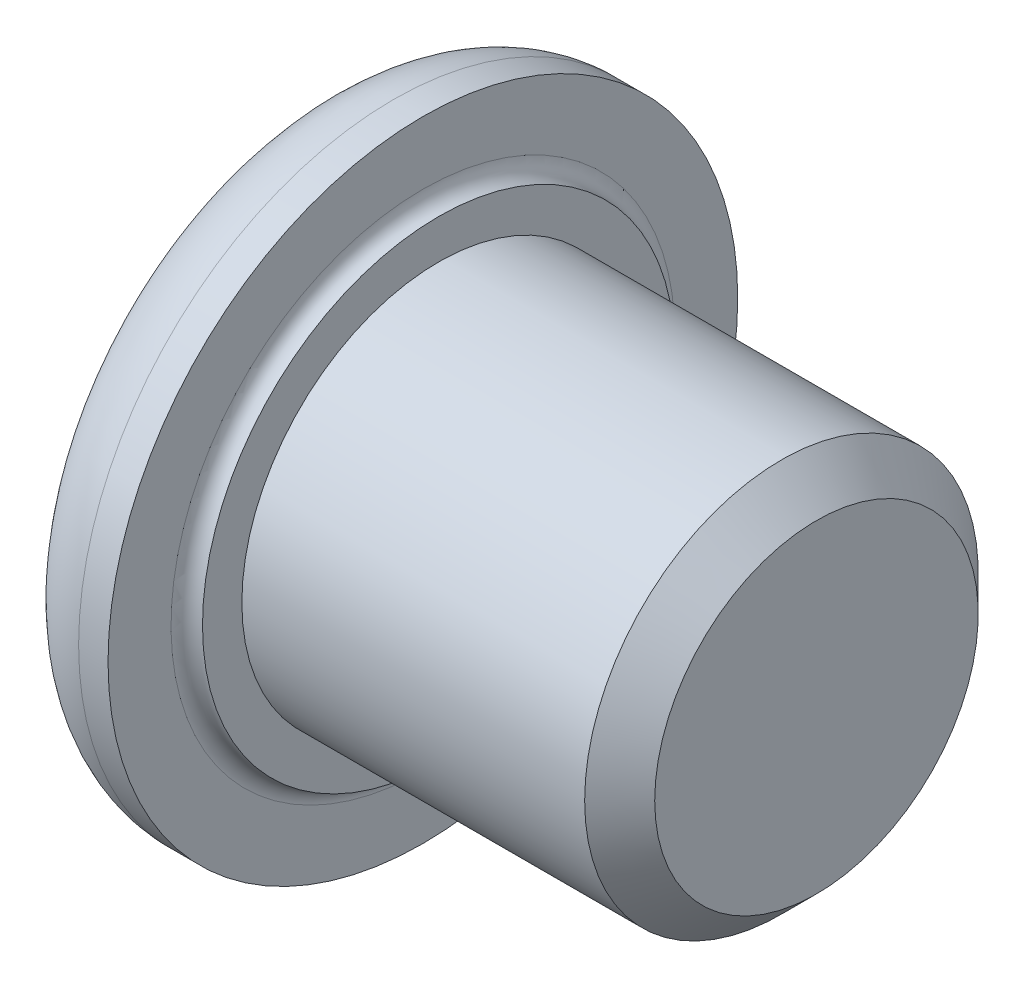
from build123d import *

# Parameters (mm, degrees)
ENL_V_MAT_EXTRU_1_DEPTH = 0.5
CONG_1_R                = 0.2
CONG_2_R                = 1


# Read off the part's stored shape, not the designer's step: M5 Filetages mécaniques Borne1
with BuildPart() as part:
    # Esquisse1 → Révolution1 (revolve)
    with BuildSketch(Plane.XY):
        with BuildLine():
            Line((0, 0), (-7, 0))
            ThreePointArc((-7, 0), (-6.746211251, 2.061552813), (-6, 4))
            Line((-6, 4), (-5, 4))
            Line((-5, 4), (-5, 3))
            Line((-5, 3), (0, 3))
            Line((0, 3), (0, 0))
        make_face()
    revolve(axis=Axis((0, 0, 0), (-1, 0, 0)))

    # Esquisse2 → Enlèv. mat.-Extru.1 (cut)
    with BuildSketch(Plane.ZY.offset(7)):
        Polygon((0.75, 1.299038106), (-0.75, 1.299038106), (-1.5, 0), (-0.75, -1.299038106), (0.75, -1.299038106), (1.5, 0), align=None)
    extrude(amount=-ENL_V_MAT_EXTRU_1_DEPTH, mode=Mode.SUBTRACT)

    # Congé1
    cong_1_edges = [part.edges().sort_by_distance(p)[0] for p in [
        (-5, -3, 0),
    ]]
    fillet(cong_1_edges, radius=CONG_1_R)

    # Congé2
    cong_2_edges = [part.edges().sort_by_distance(p)[0] for p in [
        (-6, -4, 0),
    ]]
    fillet(cong_2_edges, radius=CONG_2_R)

    # M5 Filetages mécaniques Borne1 outline → M5 Filetages mécaniques Borne1 (revolve, cut)
    with BuildSketch(Plane.YX):
        Polygon((3, 0), (2.055, 0), (2.5, -0.445), (2.5, -4.8), (3, -4.8), align=None)
    revolve(axis=Axis((0, 0, 0), (1, 0, 0)), mode=Mode.SUBTRACT)


solid = part.part
